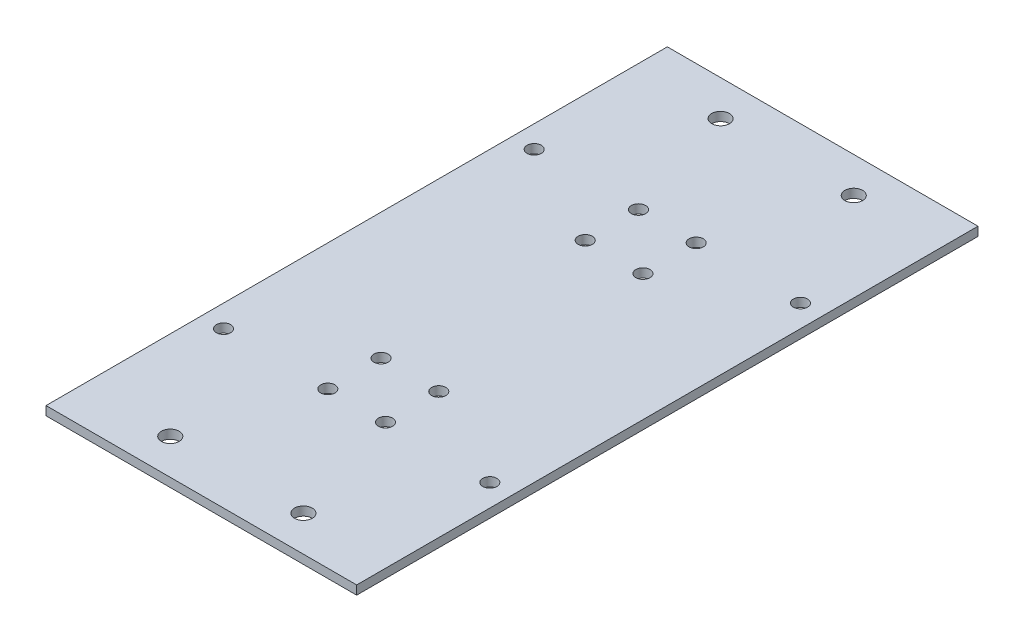
from build123d import *

# Parameters (mm, degrees)
SKETCH_2_W          = 70
SKETCH_2_H          = 140
SKETCH_2_R          = 1.6
EXTRUDE_1_DEPTH     = 2
SKETCH_3_R          = 2
CUT_EXTRUDE_1_DEPTH = 79.287930104


with BuildPart() as part:
    # 草圖2 → 填料-伸長1 (new body)
    with BuildSketch(Plane(origin=(0, 0, 0), x_dir=(1, 0, 0), z_dir=(0, 1, 0))):
        Rectangle(SKETCH_2_W, SKETCH_2_H)
        with Locations((-6.5, 35)):
            Circle(SKETCH_2_R, mode=Mode.SUBTRACT)
        with Locations((-6.5, -35)):
            Circle(SKETCH_2_R, mode=Mode.SUBTRACT)
        with Locations((-6.5, 23)):
            Circle(SKETCH_2_R, mode=Mode.SUBTRACT)
        with Locations((-6.5, -23)):
            Circle(SKETCH_2_R, mode=Mode.SUBTRACT)
        with Locations((6.5, -35)):
            Circle(SKETCH_2_R, mode=Mode.SUBTRACT)
        with Locations((6.5, -23)):
            Circle(SKETCH_2_R, mode=Mode.SUBTRACT)
        with Locations((6.5, 23)):
            Circle(SKETCH_2_R, mode=Mode.SUBTRACT)
        with Locations((6.5, 35)):
            Circle(SKETCH_2_R, mode=Mode.SUBTRACT)
        with Locations((-30, 35)):
            Circle(SKETCH_2_R, mode=Mode.SUBTRACT)
        with Locations((30, 35)):
            Circle(SKETCH_2_R, mode=Mode.SUBTRACT)
        with Locations((-30, -35)):
            Circle(SKETCH_2_R, mode=Mode.SUBTRACT)
        with Locations((30, -35)):
            Circle(SKETCH_2_R, mode=Mode.SUBTRACT)
    extrude(amount=EXTRUDE_1_DEPTH)

    # 草圖3 → 除料-伸長1 (cut, through all)
    with BuildSketch(Plane(origin=(0, 2, 0), x_dir=(1, 0, 0), z_dir=(0, 1, 0))):
        with Locations((-15, -62)):
            Circle(SKETCH_3_R)
        with Locations((-15, 62)):
            Circle(SKETCH_3_R)
        with Locations((15, -62)):
            Circle(SKETCH_3_R)
        with Locations((15, 62)):
            Circle(SKETCH_3_R)
    extrude(amount=-CUT_EXTRUDE_1_DEPTH, mode=Mode.SUBTRACT)


solid = part.part
